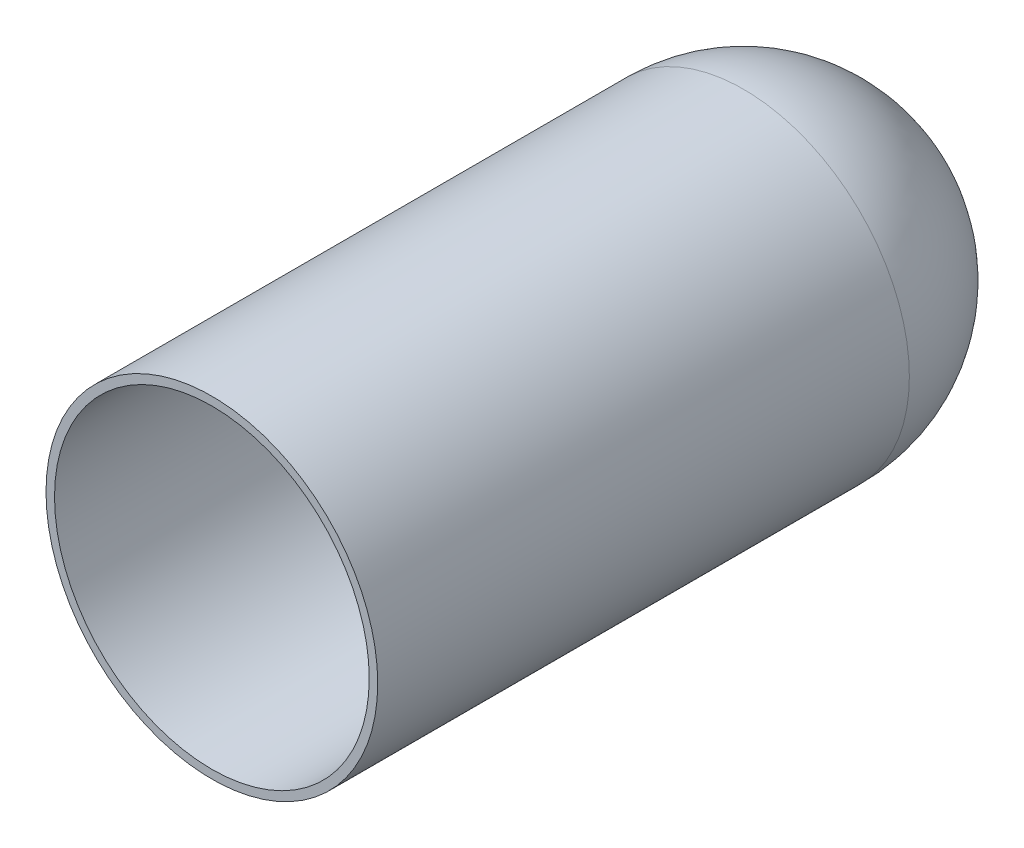
from build123d import *

# Parameters (mm, degrees)
SKETCH3_R           = 9.75
BOSS_EXTRUDE1_DEPTH = 31.25
SHELL1_T            = -0.5


# Read off the part's stored shape, not the designer's step: Dome1
with BuildPart() as part:
    # Sketch3 → Boss-Extrude1 (new body)
    with BuildSketch(Plane.XY):
        Circle(SKETCH3_R)
    extrude(amount=BOSS_EXTRUDE1_DEPTH)

    # Dome1 outline → Dome1 (revolve)
    with BuildSketch(Plane.XZ):
        with BuildLine():
            Line((0, 1e-08), (0, -9.75))
            ThreePointArc((0, -9.75), (6.89429112, -6.894291113), (9.75, 1e-08))
            Line((9.75, 1e-08), (0, 1e-08))
        make_face()
    revolve(axis=Axis((0, 0, 0), (0, 0, 1)))

    # Shell1
    shell1_openings = [part.faces().sort_by_distance(p)[0] for p in [
        (0, 0, 31.25),
    ]]
    offset(amount=SHELL1_T, openings=shell1_openings, kind=Kind.INTERSECTION)


solid = part.part
